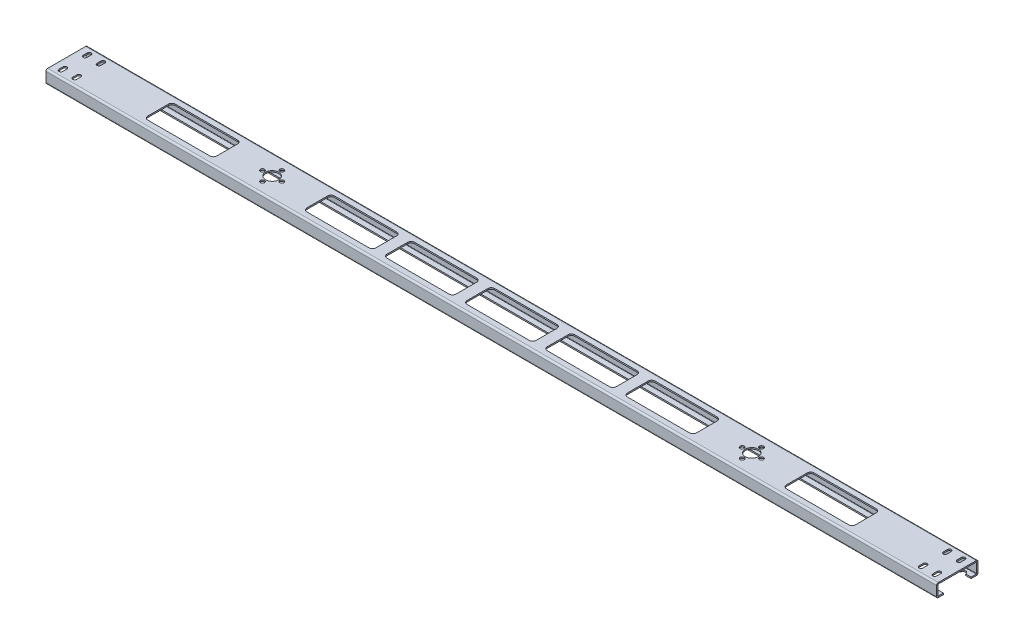
from build123d import *

# Parameters (mm, degrees)
SKETCH_1_W                       = 1289
SKETCH_1_H                       = 2
SM_BASE_FLANGE_1_DEPTH           = 60
SM_EDGE_FLANGE_1_STRIP_W         = 9
SM_EDGE_FLANGE_1_STRIP_H         = 2
SM_EDGE_FLANGE_1_STRIP_CUT_DEPTH = 1289
SM_EDGE_FLANGE_1_DEPTH           = 1289
SM_EDGE_FLANGE_2_STRIP_W         = 9
SM_EDGE_FLANGE_2_STRIP_H         = 2
SM_EDGE_FLANGE_2_STRIP_CUT_DEPTH = 1289
SM_EDGE_FLANGE_2_DEPTH           = 1289
SM_EDGE_FLANGE_3_STRIP_W         = 9
SM_EDGE_FLANGE_3_STRIP_H         = 2
SM_EDGE_FLANGE_3_STRIP_CUT_DEPTH = 1289
SM_EDGE_FLANGE_3_DEPTH           = 1289
SM_EDGE_FLANGE_4_STRIP_W         = 9
SM_EDGE_FLANGE_4_STRIP_H         = 2
SM_EDGE_FLANGE_4_STRIP_CUT_DEPTH = 1289
SM_EDGE_FLANGE_4_DEPTH           = 1289
HOLE_WIZARD_19_0_19_1_D          = 19
HOLE_WIZARD_6_0_6_1_AT_2_COUNT   = 2
HOLE_WIZARD_6_0_6_1_AT_2_PITCH   = 28
HOLE_WIZARD_6_0_6_1_AT_3_COUNT   = 2
HOLE_WIZARD_6_0_6_1_AT_3_PITCH   = 19.798989873
HOLE_WIZARD_6_0_6_1_AT_4_COUNT   = 2
HOLE_WIZARD_6_0_6_1_AT_4_PITCH   = 19.798989873
PATTERN_LINEAR_1_COUNT           = 2
PATTERN_LINEAR_1_PITCH           = 694.3
CUT_EXTRUDE_1_DEPTH              = 2
PATTERN_LINEAR_2_COUNT           = 2
PATTERN_LINEAR_2_PITCH           = 20
PATTERN_LINEAR_2_COUNT_DIR2      = 2
PATTERN_LINEAR_2_PITCH_DIR2      = 35
CUT_EXTRUDE_4_DEPTH              = 2
MIRROR_1_COPY_1_DEPTH            = 2
MIRROR_1_COPY_2_DEPTH            = 2
MIRROR_1_COPY_3_DEPTH            = 2
CUT_EXTRUDE_2_DEPTH              = 2
PATTERN_LINEAR_3_COUNT           = 5
PATTERN_LINEAR_3_PITCH           = 116
MIRROR_3_COPY_1_DEPTH            = 2
MIRROR_3_COPY_2_DEPTH            = 2


# Sheet-metal steps are written as plain solids
with BuildPart() as part:
    # Sketch 1 → 基体-法兰1 (new body)
    with BuildSketch(Plane.XY):
        with Locations((0, -1)):
            Rectangle(SKETCH_1_W, SKETCH_1_H)
    extrude(amount=SM_BASE_FLANGE_1_DEPTH)

    # 边线-法兰1 strip (across the edge) → 边线-法兰1 strip cut (cut)
    with BuildSketch(Plane(origin=(-644.5, -2, 0), x_dir=(0, 0, 1), z_dir=(1, 0, 0))):
        with Locations((-2, -1)):
            Rectangle(SM_EDGE_FLANGE_1_STRIP_W, SM_EDGE_FLANGE_1_STRIP_H)
    extrude(amount=SM_EDGE_FLANGE_1_STRIP_CUT_DEPTH, mode=Mode.SUBTRACT)

    # 边线-法兰1 section (across the edge) → 边线-法兰1 (add)
    with BuildSketch(Plane(origin=(-644.5, -2, 0), x_dir=(0, 0, 1), z_dir=(1, 0, 0))):
        with BuildLine():
            Line((0, 0.5), (0, 15))
            Line((0, 15), (2, 15))
            Line((2, 15), (2, 0.5))
            ThreePointArc((2, 0.5), (2.146446609, 0.146446609), (2.5, 0))
            Line((2.5, 0), (2.5, -2))
            ThreePointArc((2.5, -2), (0.732233047, -1.267766953), (0, 0.5))
        make_face()
    extrude(amount=SM_EDGE_FLANGE_1_DEPTH)

    # 边线-法兰2 strip (across the edge) → 边线-法兰2 strip cut (cut)
    with BuildSketch(Plane(origin=(644.5, -2, 60), x_dir=(0, 0, -1), z_dir=(-1, 0, 0))):
        with Locations((-2, -1)):
            Rectangle(SM_EDGE_FLANGE_2_STRIP_W, SM_EDGE_FLANGE_2_STRIP_H)
    extrude(amount=SM_EDGE_FLANGE_2_STRIP_CUT_DEPTH, mode=Mode.SUBTRACT)

    # 边线-法兰2 section (across the edge) → 边线-法兰2 (add)
    with BuildSketch(Plane(origin=(644.5, -2, 60), x_dir=(0, 0, -1), z_dir=(-1, 0, 0))):
        with BuildLine():
            Line((0, 0.5), (0, 15))
            Line((0, 15), (2, 15))
            Line((2, 15), (2, 0.5))
            ThreePointArc((2, 0.5), (2.146446609, 0.146446609), (2.5, 0))
            Line((2.5, 0), (2.5, -2))
            ThreePointArc((2.5, -2), (0.732233047, -1.267766953), (0, 0.5))
        make_face()
    extrude(amount=SM_EDGE_FLANGE_2_DEPTH)

    # 边线-法兰3 strip (across the edge) → 边线-法兰3 strip cut (cut)
    with BuildSketch(Plane(origin=(644.5, -17, 58), x_dir=(0, 1, 0), z_dir=(-1, 0, 0))):
        with Locations((-4, -1)):
            Rectangle(SM_EDGE_FLANGE_3_STRIP_W, SM_EDGE_FLANGE_3_STRIP_H)
    extrude(amount=SM_EDGE_FLANGE_3_STRIP_CUT_DEPTH, mode=Mode.SUBTRACT)

    # 边线-法兰3 section (across the edge) → 边线-法兰3 (add)
    with BuildSketch(Plane(origin=(644.5, -17, 58), x_dir=(0, 1, 0), z_dir=(-1, 0, 0))):
        with BuildLine():
            Line((-2, 0.5), (-2, 8))
            Line((-2, 8), (0, 8))
            Line((0, 8), (0, 0.5))
            ThreePointArc((0, 0.5), (0.146446609, 0.146446609), (0.5, 0))
            Line((0.5, 0), (0.5, -2))
            ThreePointArc((0.5, -2), (-1.267766953, -1.267766953), (-2, 0.5))
        make_face()
    extrude(amount=SM_EDGE_FLANGE_3_DEPTH)

    # 边线-法兰4 strip (across the edge) → 边线-法兰4 strip cut (cut)
    with BuildSketch(Plane(origin=(-644.5, -17, 2), x_dir=(0, 1, 0), z_dir=(1, 0, 0))):
        with Locations((-4, -1)):
            Rectangle(SM_EDGE_FLANGE_4_STRIP_W, SM_EDGE_FLANGE_4_STRIP_H)
    extrude(amount=SM_EDGE_FLANGE_4_STRIP_CUT_DEPTH, mode=Mode.SUBTRACT)

    # 边线-法兰4 section (across the edge) → 边线-法兰4 (add)
    with BuildSketch(Plane(origin=(-644.5, -17, 2), x_dir=(0, 1, 0), z_dir=(1, 0, 0))):
        with BuildLine():
            Line((-2, 0.5), (-2, 8))
            Line((-2, 8), (0, 8))
            Line((0, 8), (0, 0.5))
            ThreePointArc((0, 0.5), (0.146446609, 0.146446609), (0.5, 0))
            Line((0.5, 0), (0.5, -2))
            ThreePointArc((0.5, -2), (-1.267766953, -1.267766953), (-2, 0.5))
        make_face()
    extrude(amount=SM_EDGE_FLANGE_4_DEPTH)

    # Ø19.0 (19) 直径孔1 (through all)
    with Locations(Plane.XZ.offset(2)):
        with Locations((-347.15, 30), (347.15, 30)):
            Hole(HOLE_WIZARD_19_0_19_1_D / 2)

    # 草图17 → Ø6.0 (6) 直径孔1 (revolve, cut)
    with BuildSketch(Plane(origin=(-361.15, -2, 30), x_dir=(0, 0, -1), z_dir=(1, 0, 0))):
        Polygon((0, 0), (0, 6.802581857), (3, 5), (3, 0), align=None)
    hole_wizard_6_0_6_1 = revolve(axis=Axis((-361.15, -8.35, 30), (0, 1, 0)), mode=Mode.SUBTRACT)

    # Ø6.0 (6) 直径孔1 at 2: Ø6.0 (6) 直径孔1 ×2
    with Locations(*[(i * HOLE_WIZARD_6_0_6_1_AT_2_PITCH, 0, 0) for i in range(1, HOLE_WIZARD_6_0_6_1_AT_2_COUNT)]):
        add(hole_wizard_6_0_6_1, mode=Mode.SUBTRACT)

    # Ø6.0 (6) 直径孔1 at 3: Ø6.0 (6) 直径孔1 ×2
    with Locations(*[Vector(0.707106781186549, 0, 0.7071067811865461) * (i * HOLE_WIZARD_6_0_6_1_AT_3_PITCH) for i in range(1, HOLE_WIZARD_6_0_6_1_AT_3_COUNT)]):
        add(hole_wizard_6_0_6_1, mode=Mode.SUBTRACT)

    # Ø6.0 (6) 直径孔1 at 4: Ø6.0 (6) 直径孔1 ×2
    with Locations(*[Vector(0.707106781186549, 0, -0.7071067811865461) * (i * HOLE_WIZARD_6_0_6_1_AT_4_PITCH) for i in range(1, HOLE_WIZARD_6_0_6_1_AT_4_COUNT)]):
        add(hole_wizard_6_0_6_1, mode=Mode.SUBTRACT)

    # 阵列(线性)1: Ø6.0 (6) 直径孔1 ×2
    with Locations(*[(i * PATTERN_LINEAR_1_PITCH, 0, 0) for i in range(1, PATTERN_LINEAR_1_COUNT)]):
        add(hole_wizard_6_0_6_1, mode=Mode.SUBTRACT)

    # 阵列(线性)1 copy 1 sketch → 阵列(线性)1 copy 1 (revolve, cut)
    with BuildSketch(Plane(origin=(361.15, -2, 30), x_dir=(0, 0, -1), z_dir=(1, 0, 0))):
        Polygon((0, 0), (0, 6.802581857), (3, 5), (3, 0), align=None)
    revolve(axis=Axis((361.15, -8.35, 30), (0, 1, 0)), mode=Mode.SUBTRACT)

    # 阵列(线性)1 copy 2 sketch → 阵列(线性)1 copy 2 (revolve, cut)
    with BuildSketch(Plane(origin=(347.15, -2, 44), x_dir=(0, 0, -1), z_dir=(1, 0, 0))):
        Polygon((0, 0), (0, 6.802581857), (3, 5), (3, 0), align=None)
    revolve(axis=Axis((347.15, -8.35, 44), (0, 1, 0)), mode=Mode.SUBTRACT)

    # 阵列(线性)1 copy 3 sketch → 阵列(线性)1 copy 3 (revolve, cut)
    with BuildSketch(Plane(origin=(347.15, -2, 16), x_dir=(0, 0, -1), z_dir=(1, 0, 0))):
        Polygon((0, 0), (0, 6.802581857), (3, 5), (3, 0), align=None)
    revolve(axis=Axis((347.15, -8.35, 16), (0, 1, 0)), mode=Mode.SUBTRACT)

    # 草图19 → 切除-拉伸1 (cut)
    with BuildSketch(Plane(origin=(0, 0, 0), x_dir=(1, 0, 0), z_dir=(0, 1, 0))):
        with BuildLine():
            Line((609.749565443, -15.5), (609.749565443, -9.5))
            ThreePointArc((609.749565443, -9.5), (612.499565443, -6.75), (615.249565443, -9.5))
            Line((615.249565443, -9.5), (615.249565443, -15.5))
            ThreePointArc((615.249565443, -15.5), (612.499565443, -18.25), (609.749565443, -15.5))
        make_face()
    cut_extrude_1 = extrude(amount=-CUT_EXTRUDE_1_DEPTH, mode=Mode.SUBTRACT)

    # 阵列(线性)2: Cut-Extrude 1 2 × 2
    with Locations(*[(i * PATTERN_LINEAR_2_PITCH, 0, j * PATTERN_LINEAR_2_PITCH_DIR2) for i in range(PATTERN_LINEAR_2_COUNT) for j in range(PATTERN_LINEAR_2_COUNT_DIR2) if (i, j) != (0, 0)]):
        add(cut_extrude_1, mode=Mode.SUBTRACT)

    # 草图23 → 切除-拉伸4 (cut)
    with BuildSketch(Plane.XZ.offset(19)):
        with BuildLine():
            Line((616.499565443, 10), (608.499565443, 10))
            ThreePointArc((608.499565443, 10), (612.499565443, 6), (616.499565443, 10))
        make_face()
        with BuildLine():
            Line((636.499565443, 10), (628.499565443, 10))
            ThreePointArc((628.499565443, 10), (632.499565443, 6), (636.499565443, 10))
        make_face()
        with BuildLine():
            Line((636.499565443, 50), (628.499565443, 50))
            ThreePointArc((628.499565443, 50), (632.499565443, 54), (636.499565443, 50))
        make_face()
        with BuildLine():
            Line((616.499565443, 50), (608.499565443, 50))
            ThreePointArc((608.499565443, 50), (612.499565443, 54), (616.499565443, 50))
        make_face()
    cut_extrude_4 = extrude(amount=-CUT_EXTRUDE_4_DEPTH, mode=Mode.SUBTRACT)

    # 镜向1: 切除-拉伸1, 切除-拉伸4 across plane
    add(cut_extrude_1.mirror(Plane(origin=(0, 0, 0), x_dir=(0, 0, 1), z_dir=(1, 0, 0))), mode=Mode.SUBTRACT)
    add(cut_extrude_4.mirror(Plane(origin=(0, 0, 0), x_dir=(0, 0, 1), z_dir=(1, 0, 0))), mode=Mode.SUBTRACT)

    # 镜向1 copy 1 sketch → 镜向1 copy 1 (cut)
    with BuildSketch(Plane(origin=(0, 0, 35), x_dir=(-1, 0, 0), z_dir=(0, 1, 0))):
        with BuildLine():
            Line((609.749565443, 15.5), (609.749565443, 9.5))
            ThreePointArc((609.749565443, 9.5), (612.499565443, 6.75), (615.249565443, 9.5))
            Line((615.249565443, 9.5), (615.249565443, 15.5))
            ThreePointArc((615.249565443, 15.5), (612.499565443, 18.25), (609.749565443, 15.5))
        make_face()
    extrude(amount=-MIRROR_1_COPY_1_DEPTH, mode=Mode.SUBTRACT)

    # 镜向1 copy 2 sketch → 镜向1 copy 2 (cut)
    with BuildSketch(Plane(origin=(-20, 0, 0), x_dir=(-1, 0, 0), z_dir=(0, 1, 0))):
        with BuildLine():
            Line((609.749565443, 15.5), (609.749565443, 9.5))
            ThreePointArc((609.749565443, 9.5), (612.499565443, 6.75), (615.249565443, 9.5))
            Line((615.249565443, 9.5), (615.249565443, 15.5))
            ThreePointArc((615.249565443, 15.5), (612.499565443, 18.25), (609.749565443, 15.5))
        make_face()
    extrude(amount=-MIRROR_1_COPY_2_DEPTH, mode=Mode.SUBTRACT)

    # 镜向1 copy 3 sketch → 镜向1 copy 3 (cut)
    with BuildSketch(Plane(origin=(-20, 0, 35), x_dir=(-1, 0, 0), z_dir=(0, 1, 0))):
        with BuildLine():
            Line((609.749565443, 15.5), (609.749565443, 9.5))
            ThreePointArc((609.749565443, 9.5), (612.499565443, 6.75), (615.249565443, 9.5))
            Line((615.249565443, 9.5), (615.249565443, 15.5))
            ThreePointArc((615.249565443, 15.5), (612.499565443, 18.25), (609.749565443, 15.5))
        make_face()
    extrude(amount=-MIRROR_1_COPY_3_DEPTH, mode=Mode.SUBTRACT)

    # 草图20 → 切除-拉伸2 (cut)
    with BuildSketch(Plane(origin=(0, 0, 0), x_dir=(1, 0, 0), z_dir=(0, 1, 0))):
        with BuildLine():
            Line((-277, -10), (-187, -10))
            ThreePointArc((-187, -10), (-183.464466094, -11.464466094), (-182, -15))
            Line((-182, -15), (-182, -45))
            ThreePointArc((-182, -45), (-183.464466094, -48.535533906), (-187, -50))
            Line((-187, -50), (-277, -50))
            ThreePointArc((-277, -50), (-280.535533906, -48.535533906), (-282, -45))
            Line((-282, -45), (-282, -15))
            ThreePointArc((-282, -15), (-280.535533906, -11.464466094), (-277, -10))
        make_face()
    cut_extrude_2 = extrude(amount=-CUT_EXTRUDE_2_DEPTH, mode=Mode.SUBTRACT)

    # 阵列(线性)3: 切除-拉伸2 ×5
    with Locations(*[(i * PATTERN_LINEAR_3_PITCH, 0, 0) for i in range(1, PATTERN_LINEAR_3_COUNT)]):
        add(cut_extrude_2, mode=Mode.SUBTRACT)

    # 镜向2: 切除-拉伸2 across plane
    add(cut_extrude_2.mirror(Plane.ZY.offset(347.15)), mode=Mode.SUBTRACT)

    # 镜向3 copy 1 sketch → 镜向3 copy 1 (cut)
    with BuildSketch(Plane(origin=(694.3, 0, 0), x_dir=(1, 0, 0), z_dir=(0, 1, 0))):
        with BuildLine():
            Line((-277, -10), (-187, -10))
            ThreePointArc((-187, -10), (-183.464466094, -11.464466094), (-182, -15))
            Line((-182, -15), (-182, -45))
            ThreePointArc((-182, -45), (-183.464466094, -48.535533906), (-187, -50))
            Line((-187, -50), (-277, -50))
            ThreePointArc((-277, -50), (-280.535533906, -48.535533906), (-282, -45))
            Line((-282, -45), (-282, -15))
            ThreePointArc((-282, -15), (-280.535533906, -11.464466094), (-277, -10))
        make_face()
    extrude(amount=-MIRROR_3_COPY_1_DEPTH, mode=Mode.SUBTRACT)

    # 镜向3 copy 2 sketch → 镜向3 copy 2 (cut)
    with BuildSketch(Plane(origin=(0, 0, 0), x_dir=(-1, 0, 0), z_dir=(0, 1, 0))):
        with BuildLine():
            Line((-277, 10), (-187, 10))
            ThreePointArc((-187, 10), (-183.464466094, 11.464466094), (-182, 15))
            Line((-182, 15), (-182, 45))
            ThreePointArc((-182, 45), (-183.464466094, 48.535533906), (-187, 50))
            Line((-187, 50), (-277, 50))
            ThreePointArc((-277, 50), (-280.535533906, 48.535533906), (-282, 45))
            Line((-282, 45), (-282, 15))
            ThreePointArc((-282, 15), (-280.535533906, 11.464466094), (-277, 10))
        make_face()
    extrude(amount=-MIRROR_3_COPY_2_DEPTH, mode=Mode.SUBTRACT)


solid = part.part
